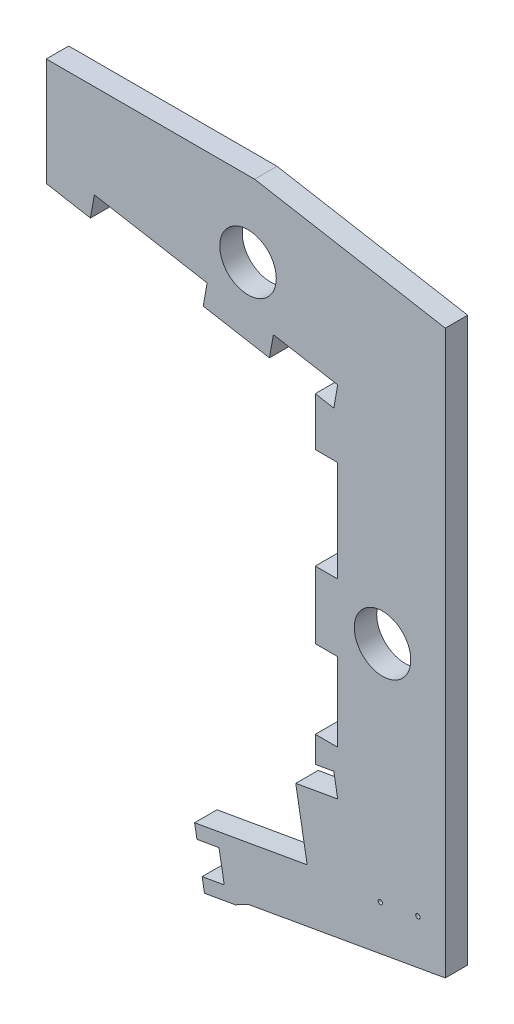
from build123d import *

# Parameters (mm, degrees)
ESQUISSE1_R             = 6.3
BOSS_EXTRU_1_DEPTH      = 5
ESQUISSE2_R             = 0.5
ENL_V_MAT_EXTRU_1_DEPTH = 5
ESQUISSE3_W             = 5
ESQUISSE3_H             = 15
BOSS_EXTRU_3_DEPTH      = 5
ENL_V_MAT_EXTRU_2_DEPTH = 5


with BuildPart() as part:
    # Esquisse1 → Boss.-Extru.1 (new body)
    with BuildSketch(Plane.XY):
        Polygon((-65, 51.461253746), (0, 40), (0, -40), (-9.359100785, -41.650261983), (-6.809077296, -56.112163836), (-31.918247866, -60.539588071), (-29.710027076, -73.063030491), (25, -63.416176602), (25, 63.800831685), (-18.444412366, 71.461253746), (-65, 71.461253746), align=None)
        with Locations((-20, 53.680805733)):
            Circle(ESQUISSE1_R, mode=Mode.SUBTRACT)
        with Locations((10, -5)):
            Circle(ESQUISSE1_R, mode=Mode.SUBTRACT)
    extrude(amount=BOSS_EXTRU_1_DEPTH)

    # Esquisse2 → Enlèv. mat.-Extru.1 (cut)
    with BuildSketch(Plane(origin=(0, 0, 0), x_dir=(-1, 0, 0), z_dir=(0, 0, -1))):
        with Locations((-9.52419964, -55.169092692)):
            Circle(ESQUISSE2_R)
        with Locations((-17.895065541, -53.693083181)):
            Circle(ESQUISSE2_R)
        Polygon((31.396602506, -63.497985917), (30.230971609, -70.108607232), (25.306932844, -69.240366344), (26.472563741, -62.629745029), align=None)
    extrude(amount=-ENL_V_MAT_EXTRU_1_DEPTH, mode=Mode.SUBTRACT)

    # Esquisse3 → Boss.-Extru.3 (add)
    with BuildSketch(Plane.XY):
        Polygon((0, -40), (0, -30), (-5, -30), (-5, -35.804501844), (-0.868240888, -35.075961235), align=None)
        with Locations((-2.5, -5)):
            Rectangle(ESQUISSE3_W, ESQUISSE3_H)
        Polygon((-0.868240888, 35.075961235), (0, 40), (0, 25), (-5, 25), (-5, 35.804501844), align=None)
        Polygon((-29.122539924, 45.135089535), (-14.350423629, 42.53036687), (-15.218664517, 37.606328105), (-29.990780813, 40.21105077), align=None)
        Polygon((-65, 51.461253746), (-65, 46.384120687), (-55.15192247, 44.64763891), (-54.283681582, 49.571677675), align=None)
    extrude(amount=BOSS_EXTRU_3_DEPTH)

    # Esquisse4 → Enlèv. mat.-Extru.2 (cut)
    with BuildSketch(Plane.XY.offset(5)):
        Polygon((-65, 70.461253746), (-18.53190103, 70.461253746), (24, 62.961732054), (24, -62.577076971), (-19.896838409, -70.317273951), (-22.829305917, -71.849773704), (35.229849594, -71.849773704), (35.229849594, 79.02138685), (-65, 79.02138685), align=None)
    extrude(amount=-ENL_V_MAT_EXTRU_2_DEPTH, mode=Mode.SUBTRACT)


solid = part.part
